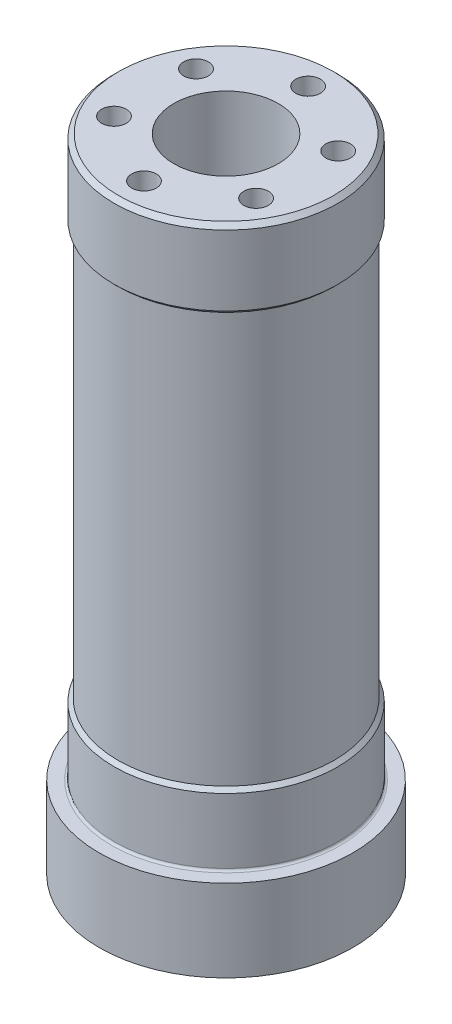
from build123d import *

# Parameters (mm, degrees)
SKETCH6_W                     = 2.15
SKETCH6_H                     = 89.5
M4_CLEARANCE_HOLE2_AT_2_COUNT = 2
M4_CLEARANCE_HOLE2_AT_2_PITCH = 11
M4_CLEARANCE_HOLE2_AT_3_COUNT = 2
M4_CLEARANCE_HOLE2_AT_3_PITCH = 19.052558883
M4_CLEARANCE_HOLE2_AT_4_COUNT = 2
M4_CLEARANCE_HOLE2_AT_4_PITCH = 22
M4_CLEARANCE_HOLE2_AT_5_COUNT = 2
M4_CLEARANCE_HOLE2_AT_5_PITCH = 19.052558883
M4_CLEARANCE_HOLE2_AT_6_COUNT = 2
M4_CLEARANCE_HOLE2_AT_6_PITCH = 11
M4_TAPPED_HOLE1_AT_2_COUNT    = 2
M4_TAPPED_HOLE1_AT_2_PITCH    = 11
M4_TAPPED_HOLE1_AT_3_COUNT    = 2
M4_TAPPED_HOLE1_AT_3_PITCH    = 19.052558883
M4_TAPPED_HOLE1_AT_4_COUNT    = 2
M4_TAPPED_HOLE1_AT_4_PITCH    = 11
M4_TAPPED_HOLE1_AT_5_COUNT    = 2
M4_TAPPED_HOLE1_AT_5_PITCH    = 19.052558883
M4_TAPPED_HOLE1_AT_6_COUNT    = 2
M4_TAPPED_HOLE1_AT_6_PITCH    = 22
M5_TAPPED_HOLE1_AT_2_COUNT    = 2
M5_TAPPED_HOLE1_AT_2_PITCH    = 18.03122292
M5_TAPPED_HOLE1_AT_3_COUNT    = 2
M5_TAPPED_HOLE1_AT_3_PITCH    = 19.596880573
M5_TAPPED_HOLE1_AT_4_COUNT    = 2
M5_TAPPED_HOLE1_AT_4_PITCH    = 25.394250395
CHAMFER1_SIZE                 = 0.6
FILLET1_R                     = 0.3
CHAMFER2_SIZE                 = 0.5
FILLET2_R                     = 0.4
FILLET3_R                     = 0.4


with BuildPart() as part:
    # Sketch1 → Revolve1 (revolve)
    with BuildSketch(Plane(origin=(0, 0, 0), x_dir=(0, 0, -1), z_dir=(1, 0, 0)), mode=Mode.PRIVATE) as revolve1_sk:
        Polygon((55, 102.5), (55, 92.5), (54.5, 92.5), (54.5, 36.5), (55, 36.5), (55, 27.5), (57, 27.5), (57, 20.5), (57, 16.5), (48.5, 16.5), (48.5, 14.5), (47, 14.5), (47, 102.5), align=None)
    revolve(revolve1_sk.sketch.rotate(Axis((0, 110.959510929, -40), (0, -1, 0)), 180), axis=Axis((0, 110.959510929, -40), (0, -1, 0)))

    # Sketch12 → M4 Tapped Hole1 (revolve, cut)
    with BuildSketch(Plane(origin=(0, 102.5, -51), x_dir=(0, 0, 1), z_dir=(1, 0, 0))):
        Polygon((0, 0), (0, 12.491420021), (1.65, 11.5), (1.65, 0), align=None)
    m4_tapped_hole1 = revolve(axis=Axis((0, 108.85, -51), (0, -1, 0)), mode=Mode.SUBTRACT)

    # M4 Tapped Hole1 at 2: M4 Tapped Hole1 ×2
    with Locations(*[Vector(0.8660254037844388, 0, 0.49999999999999983) * (i * M4_TAPPED_HOLE1_AT_2_PITCH) for i in range(1, M4_TAPPED_HOLE1_AT_2_COUNT)]):
        add(m4_tapped_hole1, mode=Mode.SUBTRACT)

    # M4 Tapped Hole1 at 3: M4 Tapped Hole1 ×2
    with Locations(*[Vector(0.5000000000000001, 0, 0.8660254037844386) * (i * M4_TAPPED_HOLE1_AT_3_PITCH) for i in range(1, M4_TAPPED_HOLE1_AT_3_COUNT)]):
        add(m4_tapped_hole1, mode=Mode.SUBTRACT)

    # M4 Tapped Hole1 at 4: M4 Tapped Hole1 ×2
    with Locations(*[Vector(-0.8660254037844386, 0, 0.5000000000000003) * (i * M4_TAPPED_HOLE1_AT_4_PITCH) for i in range(1, M4_TAPPED_HOLE1_AT_4_COUNT)]):
        add(m4_tapped_hole1, mode=Mode.SUBTRACT)

    # M4 Tapped Hole1 at 5: M4 Tapped Hole1 ×2
    with Locations(*[Vector(-0.4999999999999999, 0, 0.8660254037844388) * (i * M4_TAPPED_HOLE1_AT_5_PITCH) for i in range(1, M4_TAPPED_HOLE1_AT_5_COUNT)]):
        add(m4_tapped_hole1, mode=Mode.SUBTRACT)

    # M4 Tapped Hole1 at 6: M4 Tapped Hole1 ×2
    with Locations(*[(0, 0, i * M4_TAPPED_HOLE1_AT_6_PITCH) for i in range(1, M4_TAPPED_HOLE1_AT_6_COUNT)]):
        add(m4_tapped_hole1, mode=Mode.SUBTRACT)

    # Sketch15 → M5 Tapped Hole1 (revolve, cut)
    with BuildSketch(Plane(origin=(9.01561146, 16.5, -49.01561146), x_dir=(0, 0, -1), z_dir=(1, 0, 0))):
        Polygon((0, 0), (0, 11.2618073), (2.1, 10), (2.1, 0), align=None)
    m5_tapped_hole1 = revolve(axis=Axis((9.01561146, 10.15, -49.01561146), (0, 1, 0)), mode=Mode.SUBTRACT)

    # M5 Tapped Hole1 at 2: M5 Tapped Hole1 ×2
    with Locations(*[(-i * M5_TAPPED_HOLE1_AT_2_PITCH, 0, 0) for i in range(1, M5_TAPPED_HOLE1_AT_2_COUNT)]):
        add(m5_tapped_hole1, mode=Mode.SUBTRACT)

    # M5 Tapped Hole1 at 3: M5 Tapped Hole1 ×2
    with Locations(*[Vector(-0.09097740748886197, 0, 0.9958529566791503) * (i * M5_TAPPED_HOLE1_AT_3_PITCH) for i in range(1, M5_TAPPED_HOLE1_AT_3_COUNT)]):
        add(m5_tapped_hole1, mode=Mode.SUBTRACT)

    # M5 Tapped Hole1 at 4: M5 Tapped Hole1 ×2
    with Locations(*[Vector(-0.639843636962356, 0, 0.768505120502645) * (i * M5_TAPPED_HOLE1_AT_4_PITCH) for i in range(1, M5_TAPPED_HOLE1_AT_4_COUNT)]):
        add(m5_tapped_hole1, mode=Mode.SUBTRACT)

    # Chamfer1
    chamfer1_edges = [part.edges().sort_by_distance(p)[0] for p in [
        (0, 102.5, -55),
    ]]
    chamfer(chamfer1_edges, length=CHAMFER1_SIZE)

    # Fillet1
    fillet1_edges = [part.edges().sort_by_distance(p)[0] for p in [
        (0, 27.5, -55),
    ]]
    fillet(fillet1_edges, radius=FILLET1_R)

    # Chamfer2
    chamfer2_edges = [part.edges().sort_by_distance(p)[0] for p in [
        (0, 92.5, -54.5),
        (0, 36.5, -54.5),
    ]]
    chamfer(chamfer2_edges, length=CHAMFER2_SIZE - 0.0001)  # a hair under: the kernel refuses the full size

    # Fillet2
    fillet2_edges = [part.edges().sort_by_distance(p)[0] for p in [
        (0, 16.5, -48.5),
    ]]
    fillet(fillet2_edges, radius=FILLET2_R)


with BuildPart() as body_2:
    # Sketch2 → Revolve2 (revolve)
    with BuildSketch(Plane(origin=(0, 0, 0), x_dir=(0, 0, -1), z_dir=(1, 0, 0)), mode=Mode.PRIVATE) as revolve2_sk:
        Polygon((47, 106), (57, 106), (57, 101.5), (55, 101.5), (55, 103), (47, 103), align=None)
    revolve(revolve2_sk.sketch.rotate(Axis((0, 110.959510929, -40), (0, -1, 0)), 180), axis=Axis((0, 110.959510929, -40), (0, -1, 0)))

    # Sketch6 → M4 Clearance Hole2 (revolve, cut)
    with BuildSketch(Plane(origin=(-9.526279442, 106, -45.5), x_dir=(0, 0, 1), z_dir=(1, 0, 0))):
        with Locations((1.075, 44.75)):
            Rectangle(SKETCH6_W, SKETCH6_H)
    m4_clearance_hole2 = revolve(axis=Axis((-9.526279442, 112.35, -45.5), (0, -1, 0)), mode=Mode.SUBTRACT)

    # M4 Clearance Hole2 at 2: M4 Clearance Hole2 ×2
    with Locations(*[Vector(0.8660254037844386, 0, -0.5000000000000003) * (i * M4_CLEARANCE_HOLE2_AT_2_PITCH) for i in range(1, M4_CLEARANCE_HOLE2_AT_2_COUNT)]):
        add(m4_clearance_hole2, mode=Mode.SUBTRACT)

    # M4 Clearance Hole2 at 3: M4 Clearance Hole2 ×2
    with Locations(*[(i * M4_CLEARANCE_HOLE2_AT_3_PITCH, 0, 0) for i in range(1, M4_CLEARANCE_HOLE2_AT_3_COUNT)]):
        add(m4_clearance_hole2, mode=Mode.SUBTRACT)

    # M4 Clearance Hole2 at 4: M4 Clearance Hole2 ×2
    with Locations(*[Vector(0.8660254037844387, 0, 0.49999999999999994) * (i * M4_CLEARANCE_HOLE2_AT_4_PITCH) for i in range(1, M4_CLEARANCE_HOLE2_AT_4_COUNT)]):
        add(m4_clearance_hole2, mode=Mode.SUBTRACT)

    # M4 Clearance Hole2 at 5: M4 Clearance Hole2 ×2
    with Locations(*[Vector(0.5000000000000001, 0, 0.8660254037844387) * (i * M4_CLEARANCE_HOLE2_AT_5_PITCH) for i in range(1, M4_CLEARANCE_HOLE2_AT_5_COUNT)]):
        add(m4_clearance_hole2, mode=Mode.SUBTRACT)

    # M4 Clearance Hole2 at 6: M4 Clearance Hole2 ×2
    with Locations(*[(0, 0, i * M4_CLEARANCE_HOLE2_AT_6_PITCH) for i in range(1, M4_CLEARANCE_HOLE2_AT_6_COUNT)]):
        add(m4_clearance_hole2, mode=Mode.SUBTRACT)

    # Fillet3
    fillet3_edges = [body_2.edges().sort_by_distance(p)[0] for p in [
        (0, 103, -55),
    ]]
    fillet(fillet3_edges, radius=FILLET3_R)


solid = part.part
